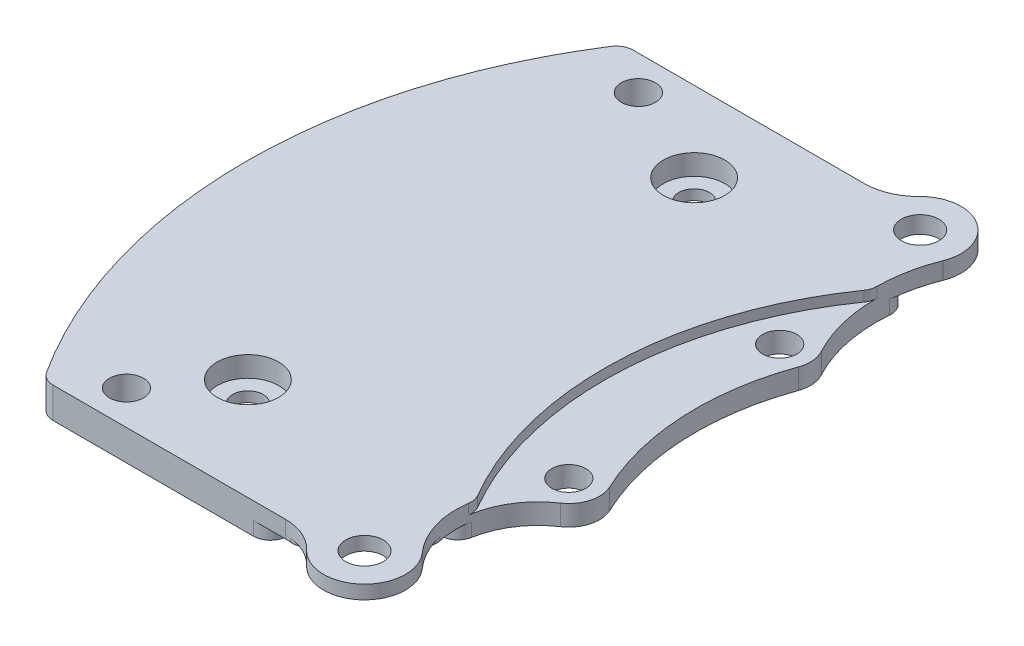
from build123d import *

# Parameters (mm, degrees)
SKETCH_1_R          = 0.5
SKETCH_1_R_2        = 0.55
SKETCH_1_R_3        = 0.45
EXTRUDE_1_DEPTH     = 0.9
SKETCH_2_R          = 10.1
CUT_EXTRUDE_1_DEPTH = 0.3
SKETCH_3_R          = 2.4
SKETCH_3_R_2        = 1.5
CUT_EXTRUDE_2_DEPTH = 0.4
SKETCH_4_R          = 1.25
CUT_EXTRUDE_3_DEPTH = 0.1
SKETCH_5_R          = 0.9
CUT_EXTRUDE_4_DEPTH = 0.6
SKETCH_6_R          = 1.2
CUT_EXTRUDE_5_DEPTH = 0.4
FILLET_START        = -1
FILLET_1_DEPTH      = 1.4
FILLET_START_2      = 0.4
FILLET_1_2_DEPTH    = 0.1
FILLET_START_3      = 0.5
FILLET_1_3_DEPTH    = 1.5
FILLET_START_4      = 0.6
FILLET_1_4_DEPTH    = 1.4


with BuildPart() as part:
    # Эскиз1 → Бобышка-Вытянуть1 (new body)
    with BuildSketch(Plane(origin=(0, 0, 0), x_dir=(1, 0, 0), z_dir=(0, 1, 0))):
        with BuildLine():
            Line((-8.874701271, 0), (-1.795461863, 0))
            ThreePointArc((-1.795461863, 0), (-1.203537037, -0.121731158), (-0.70768647, -0.467166667))
            ThreePointArc((-0.70768647, -0.467166667), (0.973552797, -0.525347996), (1.060942394, 1.154626289))
            ThreePointArc((1.060942394, 1.154626289), (0.477391661, 3.052026669), (1.522351258, 4.739841558))
            ThreePointArc((1.522351258, 4.739841558), (1.889015496, 5.247769663), (1.835416111, 5.871917665))
            ThreePointArc((1.835416111, 5.871917665), (1.116849218, 8.747445681), (1.55283729, 11.679154083))
            ThreePointArc((1.55283729, 11.679154083), (1.603016133, 12.049823116), (1.498169999, 12.408878456))
            ThreePointArc((1.498169999, 12.408878456), (0.968934134, 14.279432184), (1.278077174, 16.198674855))
            ThreePointArc((1.278077174, 16.198674855), (0.816325951, 17.647158357), (-0.694815473, 17.480514286))
            ThreePointArc((-0.694815473, 17.480514286), (-1.217938679, 17.125012349), (-1.837947895, 17))
            Line((-1.837947895, 17), (-8.874701271, 17))
            ThreePointArc((-8.874701271, 17), (-11.453066156, 8.5), (-8.874701271, 0))
        make_face()
        with Locations(Location((1.021573168, 5.487652568, 0), (0, 0, 270))):
            Circle(SKETCH_1_R, mode=Mode.SUBTRACT)
        with Locations(Location((0.162533844, 0.3591, 0), (0, 0, 270))):
            Circle(SKETCH_1_R_2, mode=Mode.SUBTRACT)
        with Locations(Location((-5.887426867, 2.992111817, 0), (0, 0, 270))):
            Circle(SKETCH_1_R_3, mode=Mode.SUBTRACT)
        with Locations(Location((-7.453066156, 1, 0), (0, 0, 270))):
            Circle(SKETCH_1_R, mode=Mode.SUBTRACT)
        with Locations(Location((-4.474879967, 14.65491132, 0), (0, 0, 270))):
            Circle(SKETCH_1_R_3, mode=Mode.SUBTRACT)
        with Locations(Location((-7.453066156, 16, 0), (0, 0, 90))):
            Circle(SKETCH_1_R, mode=Mode.SUBTRACT)
        with Locations(Location((0.705531067, 11.982588035, 0), (0, 0, 270))):
            Circle(SKETCH_1_R, mode=Mode.SUBTRACT)
        with Locations(Location((0.162533844, 16.6409, 0), (0, 0, 270))):
            Circle(SKETCH_1_R_2, mode=Mode.SUBTRACT)
    extrude(amount=EXTRUDE_1_DEPTH)

    # Эскиз2 → Вырез-Вытянуть1 (cut)
    with BuildSketch(Plane(origin=(0, 0.9, 0), x_dir=(1, 0, 0), z_dir=(0, 1, 0))):
        with Locations((9.146933844, 8.5)):
            Circle(SKETCH_2_R)
    extrude(amount=-CUT_EXTRUDE_1_DEPTH, mode=Mode.SUBTRACT)

    # Эскиз3 → Вырез-Вытянуть2 (cut)
    with BuildSketch(Plane.XZ):
        with Locations((0.162533844, -0.3591)):
            Circle(SKETCH_3_R)
        with Locations((-10.155327835, -1.531617514)):
            Circle(SKETCH_3_R_2)
        with Locations((-10.155327835, -15.468382486)):
            Circle(SKETCH_3_R_2)
    extrude(amount=-CUT_EXTRUDE_2_DEPTH, mode=Mode.SUBTRACT)

    # Эскиз4 → Вырез-Вытянуть3 (cut)
    with BuildSketch(Plane.XZ.offset(-0.4)):
        with Locations((0.162533844, -0.3591)):
            Circle(SKETCH_4_R)
    extrude(amount=-CUT_EXTRUDE_3_DEPTH, mode=Mode.SUBTRACT)

    # Эскиз5 → Вырез-Вытянуть4 (cut)
    with BuildSketch(Plane(origin=(0, 0.9, 0), x_dir=(1, 0, 0), z_dir=(0, 1, 0))):
        with Locations(Location((-5.887426867, 2.992111817, 0), (0, 0, 270))):
            Circle(SKETCH_5_R)
        with Locations(Location((-4.474879967, 14.65491132, 0), (0, 0, 270))):
            Circle(SKETCH_5_R)
    extrude(amount=-CUT_EXTRUDE_4_DEPTH, mode=Mode.SUBTRACT)

    # Эскиз6 → Вырез-Вытянуть5 (cut)
    with BuildSketch(Plane.XZ):
        with Locations((0.162533844, -16.6409)):
            Circle(SKETCH_6_R)
    extrude(amount=-CUT_EXTRUDE_5_DEPTH, mode=Mode.SUBTRACT)

    # Скругление1: read off the stored shape, not the designer's step
    # Скругление1 outline → Скругление1 (cut)
    with BuildSketch(Plane(origin=(0, 0, 0), x_dir=(1, 0, 0), z_dir=(0, 1, 0)).offset(FILLET_START)):
        with BuildLine():
            ThreePointArc((-10.564834765, 13.6372099), (-10.388255808, 13.873471068), (-10.10922841, 13.969091039))
            ThreePointArc((-10.10922841, 13.969091039), (-10.271568069, 13.972893199), (-10.432545463, 13.994221577))
            ThreePointArc((-10.432545463, 13.994221577), (-10.499800665, 13.816127249), (-10.564834765, 13.6372099))
        make_face()
        with BuildLine():
            ThreePointArc((-9.146480388, 16.578439614), (-9.032397619, 16.462881218), (-8.931474904, 16.335667907))
            ThreePointArc((-8.931474904, 16.335667907), (-9.021275661, 16.577400508), (-8.978676793, 16.831731322))
            ThreePointArc((-8.978676793, 16.831731322), (-8.809674916, 16.955996525), (-8.604572089, 17))
            Line((-8.604572089, 17), (-8.874701271, 17))
            ThreePointArc((-8.874701271, 17), (-8.950481675, 16.885472917), (-9.025231073, 16.77027027))
            ThreePointArc((-9.025231073, 16.77027027), (-9.086211401, 16.674579749), (-9.146480388, 16.578439614))
        make_face()
        with BuildLine():
            ThreePointArc((-10.10922841, 3.030908961), (-10.388255808, 3.126528932), (-10.564834765, 3.3627901))
            ThreePointArc((-10.564834765, 3.3627901), (-10.499800665, 3.183872751), (-10.432545462, 3.005778423))
            ThreePointArc((-10.432545462, 3.005778423), (-10.271568069, 3.027106801), (-10.10922841, 3.030908961))
        make_face()
        with BuildLine():
            ThreePointArc((-8.978676793, 0.168268678), (-9.021275661, 0.422599492), (-8.931474903, 0.664332093))
            ThreePointArc((-8.931474903, 0.664332093), (-9.032397619, 0.537118782), (-9.146480388, 0.421560386))
            ThreePointArc((-9.146480388, 0.421560386), (-9.086211401, 0.325420251), (-9.025231073, 0.22972973))
            ThreePointArc((-9.025231073, 0.22972973), (-8.950481675, 0.114527083), (-8.874701271, 0))
            Line((-8.874701271, 0), (-8.604572089, 0))
            ThreePointArc((-8.604572089, 0), (-8.809674916, 0.044003475), (-8.978676793, 0.168268678))
        make_face()
        with BuildLine():
            ThreePointArc((-0.694815473, 17.480514286), (-1.112314109, 17.17400715), (-1.605848887, 17.016923865))
            ThreePointArc((-1.605848887, 17.016923865), (-1.219826633, 16.911729191), (-1.034538008, 16.557120639))
            ThreePointArc((-1.034538008, 16.557120639), (-0.963665757, 17.055236166), (-0.694815473, 17.480514286))
        make_face()
        with BuildLine():
            ThreePointArc((-2.234631739, 0.475706897), (-2.389183693, 0.137959566), (-2.734041235, 0))
            Line((-2.734041235, 0), (-2.210448918, 0))
            ThreePointArc((-2.210448918, 0), (-2.23437105, 0.237252027), (-2.234631739, 0.475706897))
        make_face()
        with BuildLine():
            ThreePointArc((1.278077174, 16.198674855), (0.926926141, 15.715857074), (0.386577368, 15.462000301))
            ThreePointArc((0.386577368, 15.462000301), (0.815072231, 15.341843176), (0.978072419, 14.92774594))
            ThreePointArc((0.978072419, 14.92774594), (1.081728132, 15.5741506), (1.278077174, 16.198674855))
        make_face()
        with BuildLine():
            ThreePointArc((0.030324762, 2.755455725), (0.244370036, 2.757704352), (0.457764308, 2.740872234))
            ThreePointArc((0.457764308, 2.740872234), (0.466881934, 2.954735051), (0.495018839, 3.16693484))
            ThreePointArc((0.495018839, 3.16693484), (0.33425049, 2.880359605), (0.030324762, 2.755455725))
        make_face()
    extrude(amount=FILLET_1_DEPTH, mode=Mode.SUBTRACT)

    # Fillet 1 2 outline → Fillet 1 2 (cut)
    with BuildSketch(Plane(origin=(0, 0, 0), x_dir=(1, 0, 0), z_dir=(0, 1, 0)).offset(FILLET_START_2)):
        with BuildLine():
            ThreePointArc((-9.025231073, 16.77027027), (-8.844222736, 16.938825213), (-8.604572089, 17))
            Line((-8.604572089, 17), (-8.874701271, 17))
            ThreePointArc((-8.874701271, 17), (-8.950481675, 16.885472917), (-9.025231073, 16.77027027))
        make_face()
        with BuildLine():
            ThreePointArc((-8.604572089, 0), (-8.844222736, 0.061174787), (-9.025231073, 0.22972973))
            ThreePointArc((-9.025231073, 0.22972973), (-8.950481675, 0.114527083), (-8.874701271, 0))
            Line((-8.874701271, 0), (-8.604572089, 0))
        make_face()
        with BuildLine():
            ThreePointArc((-1.08403646, 0.451633648), (-1.262452429, 0.10463646), (-1.635863903, -0.00851467))
            ThreePointArc((-1.635863903, -0.00851467), (-1.25040696, -0.102532593), (-0.903083615, -0.294321327))
            ThreePointArc((-0.903083615, -0.294321327), (-1.052235792, 0.064422668), (-1.08403646, 0.451633648))
        make_face()
        with BuildLine():
            ThreePointArc((0.884565826, 1.379477291), (0.660848396, 1.77945859), (0.517239852, 2.214672463))
            ThreePointArc((0.517239852, 2.214672463), (0.431918135, 1.807119305), (0.067603665, 1.605490092))
            ThreePointArc((0.067603665, 1.605490092), (0.49582743, 1.563847021), (0.884565826, 1.379477291))
        make_face()
    extrude(amount=FILLET_1_2_DEPTH, mode=Mode.SUBTRACT)

    # Fillet 1 3 outline → Fillet 1 3 (cut)
    with BuildSketch(Plane(origin=(0, 0, 0), x_dir=(1, 0, 0), z_dir=(0, 1, 0)).offset(FILLET_START_3)):
        with BuildLine():
            ThreePointArc((-9.025231073, 16.77027027), (-8.844222736, 16.938825213), (-8.604572089, 17))
            Line((-8.604572089, 17), (-8.874701271, 17))
            ThreePointArc((-8.874701271, 17), (-8.950481675, 16.885472917), (-9.025231073, 16.77027027))
        make_face()
        with BuildLine():
            ThreePointArc((-8.604572089, 0), (-8.844222736, 0.061174787), (-9.025231073, 0.22972973))
            ThreePointArc((-9.025231073, 0.22972973), (-8.950481675, 0.114527083), (-8.874701271, 0))
            Line((-8.874701271, 0), (-8.604572089, 0))
        make_face()
    extrude(amount=FILLET_1_3_DEPTH, mode=Mode.SUBTRACT)

    # Fillet 1 4 outline → Fillet 1 4 (cut)
    with BuildSketch(Plane(origin=(0, 0, 0), x_dir=(1, 0, 0), z_dir=(0, 1, 0)).offset(FILLET_START_4)):
        with BuildLine():
            ThreePointArc((0.963003545, 14.4188922), (0.96158445, 14.49585524), (0.961482029, 14.572831294))
            ThreePointArc((0.961482029, 14.572831294), (0.937837832, 14.424463631), (0.871185578, 14.289817841))
            ThreePointArc((0.871185578, 14.289817841), (0.916841519, 14.354535024), (0.963003545, 14.4188922))
        make_face()
        with BuildLine():
            ThreePointArc((0.42008242, 3.415507477), (0.478926522, 3.25893209), (0.482835834, 3.091710089))
            ThreePointArc((0.482835834, 3.091710089), (0.496570271, 3.175545649), (0.513263178, 3.258842605))
            ThreePointArc((0.513263178, 3.258842605), (0.466319363, 3.336964825), (0.42008242, 3.415507477))
        make_face()
    extrude(amount=FILLET_1_4_DEPTH, mode=Mode.SUBTRACT)


solid = part.part
